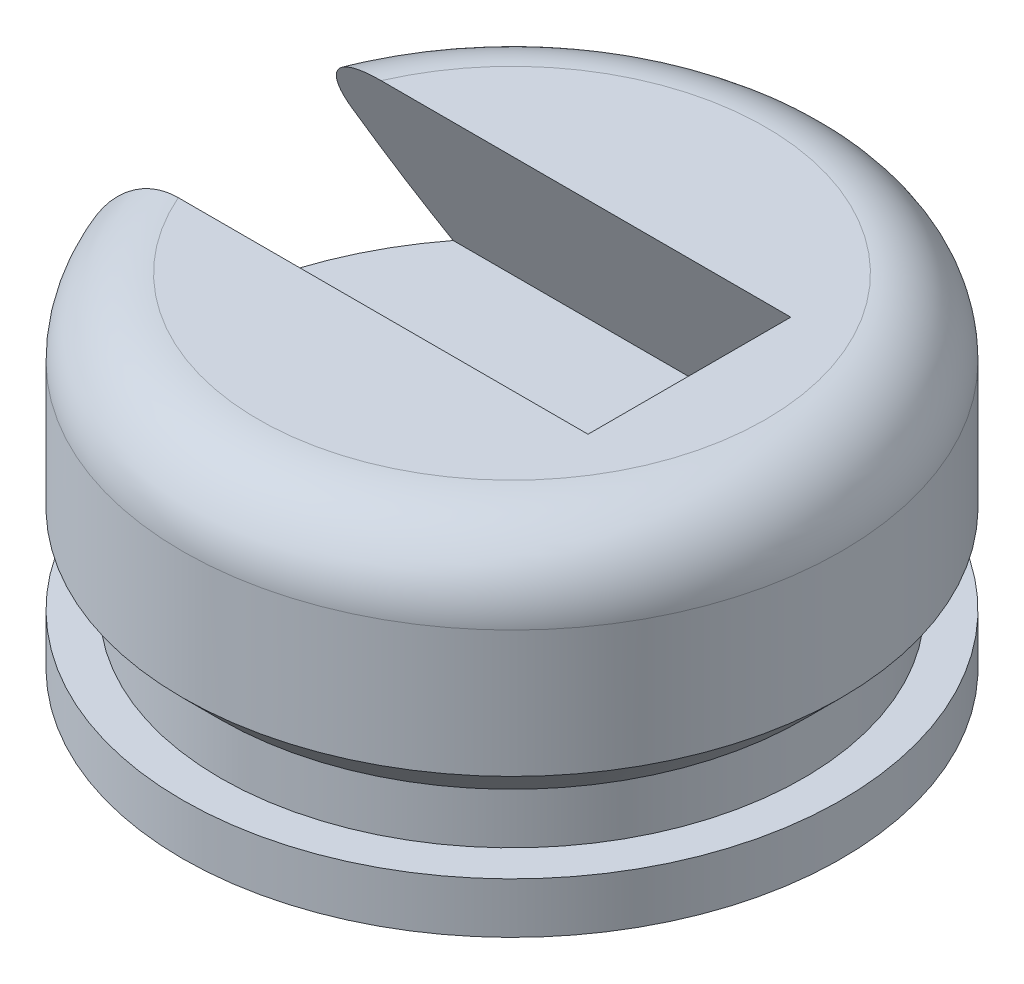
from build123d import *

# Parameters (mm, degrees)
SKETCH1_R               = 13
BOSS_EXTRUDE1_DEPTH     = 2
SKETCH2_R               = 11.5
BOSS_EXTRUDE2_DEPTH     = 1.5
SKETCH3_R               = 13
BOSS_EXTRUDE4_DEPTH     = 10
CUT_EXTRUDE1_DEPTH      = 7
CUT_EXTRUDE1_DEPTH_BACK = 23.808989456
CHAMFER1_SIZE           = 2
FILLET1_R               = 3


with BuildPart() as part:
    # Sketch1 → Boss-Extrude1 (new body)
    with BuildSketch(Plane(origin=(0, 0, 0), x_dir=(1, 0, 0), z_dir=(0, 1, 0))):
        with Locations(Location((0, 0, 0), (0, 0, 270))):
            Circle(SKETCH1_R)
    extrude(amount=BOSS_EXTRUDE1_DEPTH)

    # Sketch2 → Boss-Extrude2 (add)
    with BuildSketch(Plane(origin=(0, 2, 0), x_dir=(1, 0, 0), z_dir=(0, 1, 0))):
        with Locations(Location((0, 0, 0), (0, 0, 270))):
            Circle(SKETCH2_R)
    extrude(amount=BOSS_EXTRUDE2_DEPTH)

    # Sketch3 → Boss-Extrude4 (add)
    with BuildSketch(Plane(origin=(0, 3.5, 0), x_dir=(1, 0, 0), z_dir=(0, 1, 0))):
        with Locations(Location((0, 0, 0), (0, 0, 270))):
            Circle(SKETCH3_R)
    extrude(amount=BOSS_EXTRUDE4_DEPTH)

    # Sketch4 → Cut-Extrude1 (cut, two sides: drawn at the far end of the back side and taken through both)
    with BuildSketch(Plane(origin=(0, 0, 0), x_dir=(0, 0, -1), z_dir=(1, 0, 0)).offset(-CUT_EXTRUDE1_DEPTH_BACK)):
        Polygon((-0.040911755, 5.5), (-8.040911755, 5.5), (-4, 13.5), (0, 13.5), (4, 13.5), (7.959088245, 5.5), align=None)
    extrude(amount=CUT_EXTRUDE1_DEPTH + CUT_EXTRUDE1_DEPTH_BACK, mode=Mode.SUBTRACT)

    # Chamfer1
    # the kernel refuses this chamfer: 2 mm, written as the material it takes off along each edge
    with BuildSketch(Plane(origin=(0, 3.5, 0), x_dir=(0, 0, 1), z_dir=(-1, 0, 0))) as chamfer1_piece_1_section:
        Polygon((13, CHAMFER1_SIZE), (13 - CHAMFER1_SIZE, 0), (13, 0), align=None)
    chamfer1_piece_1 = revolve(axis=Axis((0, 3.5, 0), (0, 1, 0)), mode=Mode.PRIVATE)
    chamfer1_piece_1 = chamfer1_piece_1 - Plane(origin=(0, 4.739987211, 0), x_dir=(0, 0, 1), z_dir=(0, -1, 0)) * Cylinder(11.5, 52, mode=Mode.PRIVATE)
    add(chamfer1_piece_1, mode=Mode.SUBTRACT)

    # Fillet1
    fillet1_edges = [part.edges().sort_by_distance(p)[0] for p in [
        (13, 13.5, 0),
    ]]
    fillet(fillet1_edges, radius=FILLET1_R)


solid = part.part
